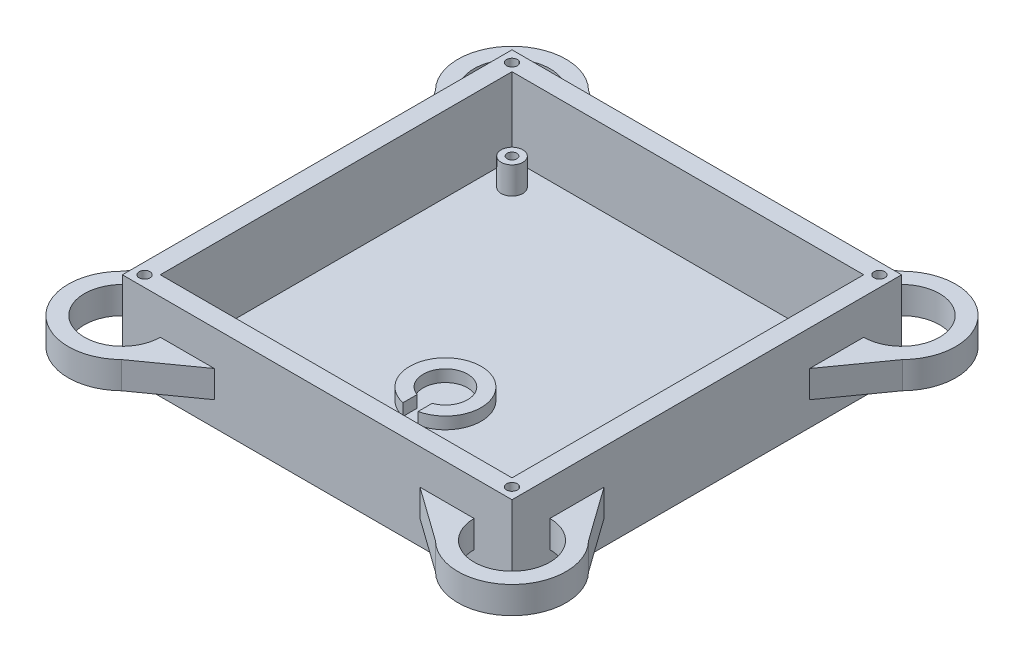
from build123d import *

# Parameters (mm, degrees)
SKETCH1_W                = 65
SKETCH1_H                = 65
BOSS_EXTRUDE1_DEPTH      = 14
SKETCH2_W                = 72
SKETCH2_H                = 72
BOSS_EXTRUDE2_DEPTH      = 2
SKETCH3_R                = 2
SKETCH3_R_2              = 0.9
BOSS_EXTRUDE3_DEPTH      = 5
SKETCH4_R                = 1
CUT_EXTRUDE1_DEPTH       = 8
BOSS_EXTRUDE6_DEPTH      = 2.5
BOSS_EXTRUDE6_DEPTH_BACK = 2.5
BOSS_EXTRUDE7_DEPTH      = 2.2


with BuildPart() as part:
    # Sketch1 → Boss-Extrude1 (new body)
    with BuildSketch(Plane(origin=(0, 0, 0), x_dir=(1, 0, 0), z_dir=(0, 1, 0))):
        Polygon((33.5, 34.5), (-1, 34.5), (-38.5, 34.5), (-38.5, -37.5), (33.5, -37.5), align=None)
        with Locations((-2.5, -1.5)):
            Rectangle(SKETCH1_W, SKETCH1_H, mode=Mode.SUBTRACT)
    extrude(amount=BOSS_EXTRUDE1_DEPTH)

    # Sketch2 → Boss-Extrude2 (add)
    with BuildSketch(Plane.XZ):
        with Locations((-2.5, 1.5)):
            Rectangle(SKETCH2_W, SKETCH2_H)
    extrude(amount=BOSS_EXTRUDE2_DEPTH)

    # Sketch3 → Boss-Extrude3 (add)
    # profile 1 of 4: a face of its own
    with BuildSketch(Plane(origin=(0, 0, 0), x_dir=(1, 0, 0), z_dir=(0, 1, 0))):
        with Locations((25.5, 26.5)):
            Circle(SKETCH3_R)
        with Locations((25.5, 26.5)):
            Circle(SKETCH3_R_2, mode=Mode.SUBTRACT)
    # profile 2 of 4: a face of its own
    with BuildSketch(Plane(origin=(0, 0, 0), x_dir=(1, 0, 0), z_dir=(0, 1, 0))):
        with Locations((25.5, -29.5)):
            Circle(SKETCH3_R)
        with Locations((25.5, -29.5)):
            Circle(SKETCH3_R_2, mode=Mode.SUBTRACT)
    # profile 3 of 4: a face of its own
    with BuildSketch(Plane(origin=(0, 0, 0), x_dir=(1, 0, 0), z_dir=(0, 1, 0))):
        with Locations((-30.5, -29.5)):
            Circle(SKETCH3_R)
        with Locations((-30.5, -29.5)):
            Circle(SKETCH3_R_2, mode=Mode.SUBTRACT)
    # profile 4 of 4: a face of its own
    with BuildSketch(Plane(origin=(0, 0, 0), x_dir=(1, 0, 0), z_dir=(0, 1, 0))):
        with Locations((-30.5, 26.5)):
            Circle(SKETCH3_R)
        with Locations((-30.5, 26.5)):
            Circle(SKETCH3_R_2, mode=Mode.SUBTRACT)
    extrude(amount=BOSS_EXTRUDE3_DEPTH)

    # Sketch4 → Cut-Extrude1 (cut)
    with BuildSketch(Plane(origin=(0, 14, 0), x_dir=(1, 0, 0), z_dir=(0, 1, 0))):
        with Locations((-36.449390335, 32.449390335)):
            Circle(SKETCH4_R)
        with Locations((31.449390335, 32.449390335)):
            Circle(SKETCH4_R)
        with Locations((31.449390335, -35.449390335)):
            Circle(SKETCH4_R)
        with Locations((-36.449390335, -35.449390335)):
            Circle(SKETCH4_R)
    extrude(amount=-CUT_EXTRUDE1_DEPTH, mode=Mode.SUBTRACT)

    # Sketch5 → Boss-Extrude6 (add, two sides: drawn at the far end of the back side and taken through both)
    with BuildSketch(Plane(origin=(0, 5, 0), x_dir=(1, 0, 0), z_dir=(0, 1, 0)).offset(-BOSS_EXTRUDE6_DEPTH_BACK)):
        with BuildLine():
            Line((16.5, 34.5), (26.5, 34.5))
            ThreePointArc((26.5, 34.5), (38.449747468, 39.449747468), (33.5, 27.5))
            Line((33.5, 27.5), (33.5, 17.5))
            Line((33.5, 17.5), (40.641428429, 27.5))
            ThreePointArc((40.641428429, 27.5), (40.571067812, 41.571067812), (26.5, 41.641428429))
            Line((26.5, 41.641428429), (16.5, 34.5))
        make_face()
        with BuildLine():
            ThreePointArc((-38.5, 27.5), (-43.449747468, 39.449747468), (-31.5, 34.5))
            Line((-31.5, 34.5), (-21.5, 34.5))
            Line((-21.5, 34.5), (-31.5, 41.641428429))
            ThreePointArc((-31.5, 41.641428429), (-45.571067812, 41.571067812), (-45.641428429, 27.5))
            Line((-45.641428429, 27.5), (-38.5, 17.5))
            Line((-38.5, 17.5), (-38.5, 27.5))
        make_face()
        with BuildLine():
            ThreePointArc((33.5, -30.5), (38.449747468, -42.449747468), (26.5, -37.5))
            Line((26.5, -37.5), (16.5, -37.5))
            Line((16.5, -37.5), (26.5, -44.641428429))
            ThreePointArc((26.5, -44.641428429), (40.571067812, -44.571067812), (40.641428429, -30.5))
            Line((40.641428429, -30.5), (33.5, -20.5))
            Line((33.5, -20.5), (33.5, -30.5))
        make_face()
        with BuildLine():
            ThreePointArc((-31.5, -37.5), (-43.449747468, -42.449747468), (-38.5, -30.5))
            Line((-38.5, -30.5), (-38.5, -20.5))
            Line((-38.5, -20.5), (-45.641428429, -30.5))
            ThreePointArc((-45.641428429, -30.5), (-45.571067812, -44.571067812), (-31.5, -44.641428429))
            Line((-31.5, -44.641428429), (-21.5, -37.5))
            Line((-21.5, -37.5), (-31.5, -37.5))
        make_face()
    extrude(amount=BOSS_EXTRUDE6_DEPTH + BOSS_EXTRUDE6_DEPTH_BACK)

    # Sketch10 → Boss-Extrude7 (add)
    with BuildSketch(Plane(origin=(0, 0, 0), x_dir=(1, 0, 0), z_dir=(0, 1, 0))):
        with BuildLine():
            Line((-3.9, -17.653569774), (-3.9, -20.249806199))
            ThreePointArc((-3.9, -20.249806199), (-2.5, -7.2), (-1.1, -20.249806199))
            Line((-1.1, -20.249806199), (-1.1, -17.653569774))
            ThreePointArc((-1.1, -17.653569774), (-2.5, -9.7), (-3.9, -17.653569774))
        make_face()
    extrude(amount=BOSS_EXTRUDE7_DEPTH)


solid = part.part
